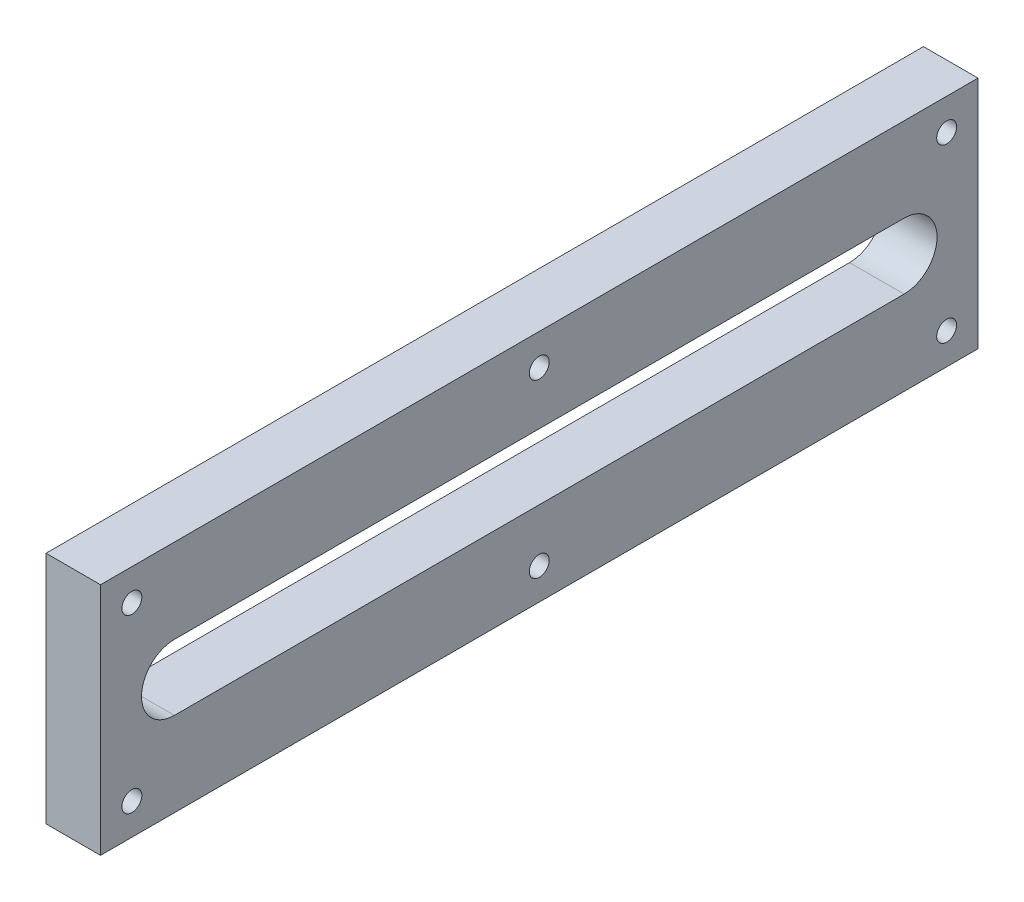
from build123d import *

# Parameters (mm, degrees)
SKETCH1_W              = 177.8
SKETCH1_H              = 47.498
BOSS_EXTRUDE1_DEPTH    = 11.049
F_10_32_TAPPED_HOLE1_D = 4.0386


with BuildPart() as part:
    # Sketch1 → Boss-Extrude1 (new body)
    with BuildSketch(Plane(origin=(0, 0, 0), x_dir=(0, 0, -1), z_dir=(1, 0, 0))):
        Rectangle(SKETCH1_W, SKETCH1_H)
        with BuildLine():
            Line((-73.9252522, 6.6675), (73.9252522, 6.6675))
            ThreePointArc((73.9252522, 6.6675), (80.5927522, 0), (73.9252522, -6.6675))
            Line((73.9252522, -6.6675), (-73.9252522, -6.6675))
            ThreePointArc((-73.9252522, -6.6675), (-80.5927522, 0), (-73.9252522, 6.6675))
        make_face(mode=Mode.SUBTRACT)
    extrude(amount=BOSS_EXTRUDE1_DEPTH)

    # #10-32 Tapped Hole1 (through all)
    with Locations(Plane(origin=(11.049, 0, 0), x_dir=(0, 0, -1), z_dir=(1, 0, 0))):
        with Locations((-82.55, 17.399), (-82.55, -17.399), (0, -17.399), (82.55, -17.399), (82.55, 17.399), (0, 17.399)):
            Hole(F_10_32_TAPPED_HOLE1_D / 2)


solid = part.part
